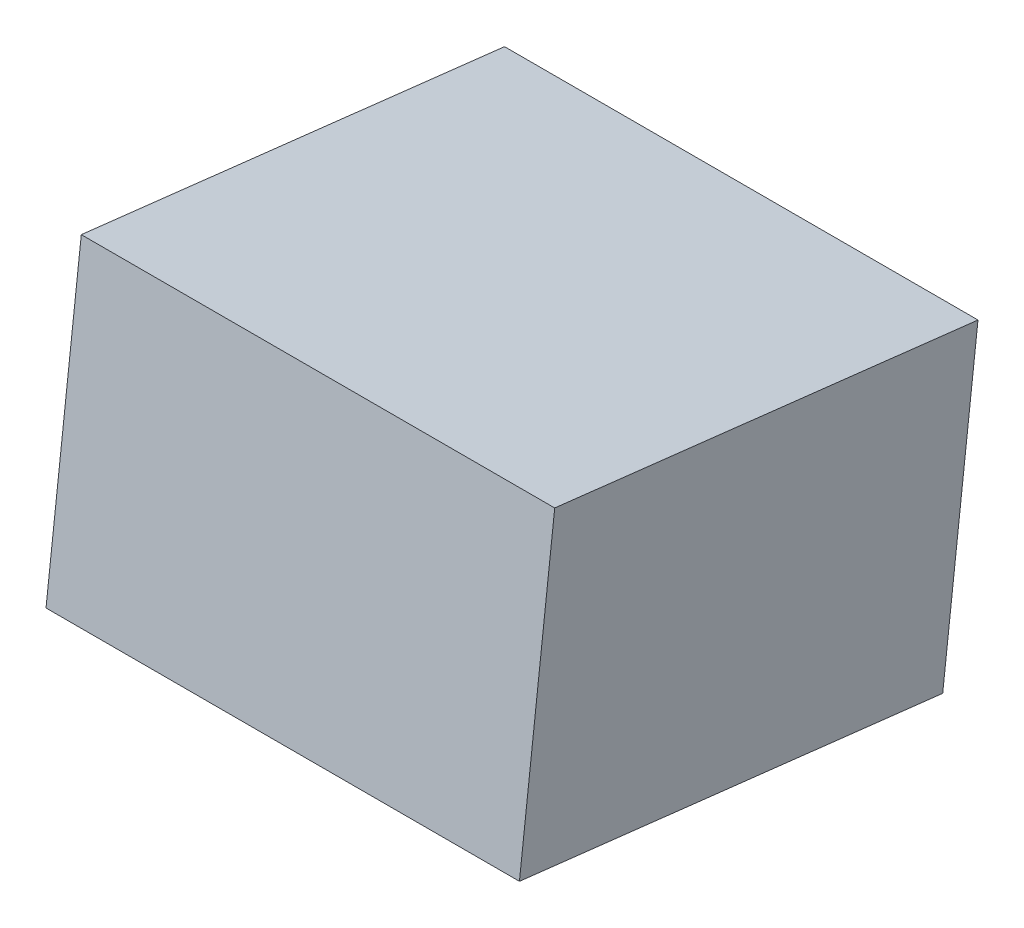
from build123d import *

# Parameters (mm, degrees)
SKETCH1_W           = 200
SKETCH1_H           = 180
BOSS_EXTRUDE1_DEPTH = 130


with BuildPart() as part:
    # Sketch1 → Boss-Extrude1 (new body)
    with BuildSketch(Plane(origin=(0, 358.879876801, -41.422455829), x_dir=(1, 0, 0), z_dir=(-6.837425950214788e-15, 0.9934047622419533, -0.1146602736566085))):
        with Locations((-135, 150.244347434)):
            Rectangle(SKETCH1_W, SKETCH1_H)
    extrude(amount=BOSS_EXTRUDE1_DEPTH)


solid = part.part
